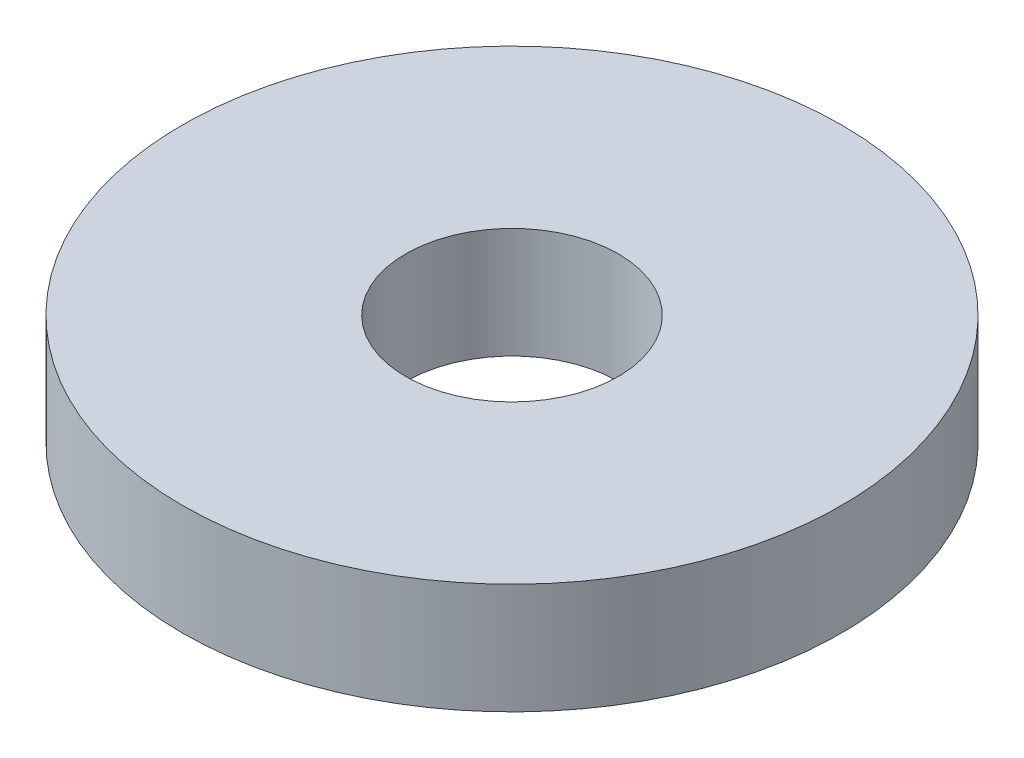
from build123d import *

# Parameters (mm, degrees)
SKETCH1_R           = 77.5
BOSS_EXTRUDE1_DEPTH = 26
SKETCH2_R           = 25
CUT_EXTRUDE1_DEPTH  = 113.643242141


with BuildPart() as part:
    # Sketch1 → Boss-Extrude1 (new body)
    with BuildSketch(Plane(origin=(0, 0, 0), x_dir=(1, 0, 0), z_dir=(0, 1, 0))):
        Circle(SKETCH1_R)
    extrude(amount=BOSS_EXTRUDE1_DEPTH)

    # Sketch2 → Cut-Extrude1 (cut, through all)
    with BuildSketch(Plane(origin=(0, 0, 0), x_dir=(1, 0, 0), z_dir=(0, 1, 0))):
        Circle(SKETCH2_R)
    extrude(amount=CUT_EXTRUDE1_DEPTH, mode=Mode.SUBTRACT)


solid = part.part
